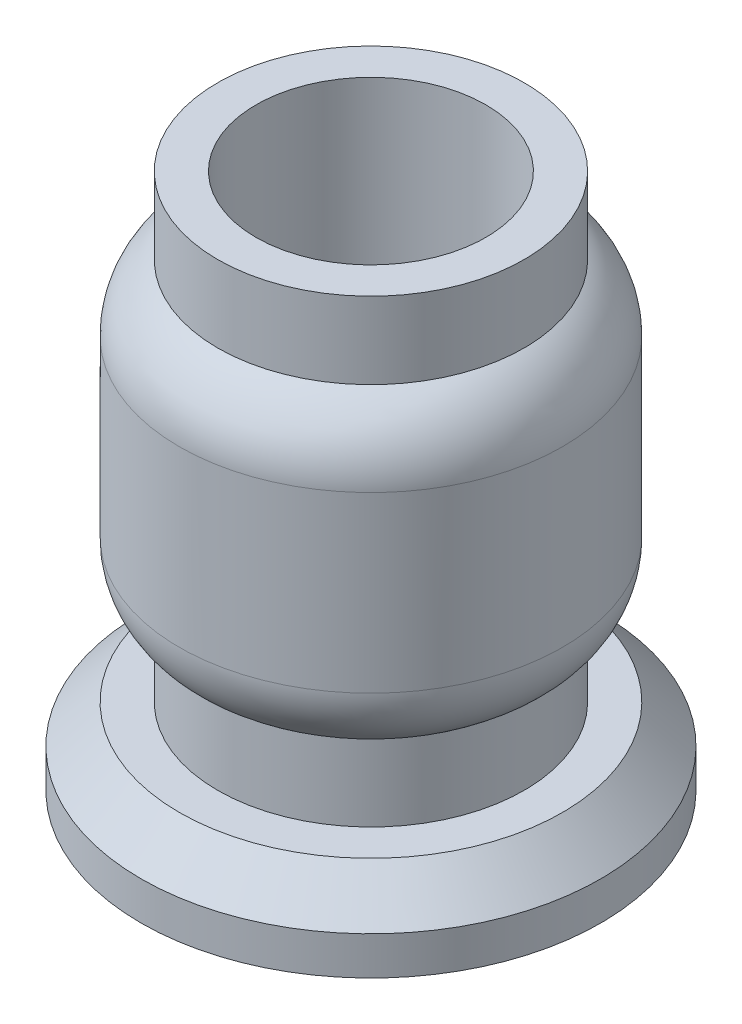
from build123d import *

# Parameters (mm, degrees)
SKETCH1_R           = 3
BOSS_EXTRUDE1_DEPTH = 1
CHAMFER1_SIZE       = 0.5
SKETCH2_R           = 2
BOSS_EXTRUDE2_DEPTH = 1
SKETCH3_R           = 2.5
BOSS_EXTRUDE3_DEPTH = 4
SKETCH4_R           = 2
BOSS_EXTRUDE4_DEPTH = 1
FILLET1_R           = 1
FILLET2_R           = 1
SKETCH5_R           = 1.5
CUT_EXTRUDE1_DEPTH  = 10


with BuildPart() as part:
    # Sketch1 → Boss-Extrude1 (new body)
    with BuildSketch(Plane(origin=(0, 0, 0), x_dir=(1, 0, 0), z_dir=(0, 1, 0))):
        with Locations(Location((0, 0, 0), (0, 0, 270))):
            Circle(SKETCH1_R)
    extrude(amount=BOSS_EXTRUDE1_DEPTH)

    # Chamfer1
    chamfer1_edges = [part.edges().sort_by_distance(p)[0] for p in [
        (0, 1, -3),
    ]]
    chamfer(chamfer1_edges, length=CHAMFER1_SIZE)

    # Sketch2 → Boss-Extrude2 (add)
    with BuildSketch(Plane(origin=(0, 1, 0), x_dir=(1, 0, 0), z_dir=(0, 1, 0))):
        with Locations(Location((0, 0, 0), (0, 0, 270))):
            Circle(SKETCH2_R)
    extrude(amount=BOSS_EXTRUDE2_DEPTH)

    # Sketch3 → Boss-Extrude3 (add)
    with BuildSketch(Plane(origin=(0, 2, 0), x_dir=(1, 0, 0), z_dir=(0, 1, 0))):
        with Locations(Location((0, 0, 0), (0, 0, 270))):
            Circle(SKETCH3_R)
    extrude(amount=BOSS_EXTRUDE3_DEPTH)

    # Sketch4 → Boss-Extrude4 (add)
    with BuildSketch(Plane(origin=(0, 6, 0), x_dir=(1, 0, 0), z_dir=(0, 1, 0))):
        with Locations(Location((0, 0, 0), (0, 0, 270))):
            Circle(SKETCH4_R)
    extrude(amount=BOSS_EXTRUDE4_DEPTH)

    # Fillet1
    # the kernel refuses this fillet: 1 mm, written as the material it takes off along each edge
    with BuildSketch(Plane(origin=(0, 6, 0), x_dir=(0, 0, 1), z_dir=(-1, 0, 0))) as fillet1_piece_1:
        with BuildLine():
            CenterArc((1.5, -0.866025404), FILLET1_R, 0, 60)
            Line((2, 0), (2.01, 0.017320508))
            ThreePointArc((2.01, 0.017320508), (2.25, 0.02), (2.5, 0.02))
            Line((2.5, 0.02), (2.52, 0))
            Line((2.52, 0), (2.52, -0.866025404))
            Line((2.52, -0.866025404), (2.5, -0.866025404))
        make_face()
    revolve(axis=Axis((0, 6, 0), (0, 1, 0)), mode=Mode.SUBTRACT)

    # Fillet2
    # the kernel refuses this fillet: 1 mm, written as the material it takes off along each edge
    with BuildSketch(Plane(origin=(0, 2, 0), x_dir=(0, 0, 1), z_dir=(-1, 0, 0))) as fillet2_piece_1:
        with BuildLine():
            CenterArc((1.5, 0.866025404), FILLET2_R, 300, 60)
            Line((2, 0), (2.01, -0.017320508))
            ThreePointArc((2.01, -0.017320508), (2.25, -0.02), (2.5, -0.02))
            Line((2.5, -0.02), (2.52, 0))
            Line((2.52, 0), (2.52, 0.866025404))
            Line((2.52, 0.866025404), (2.5, 0.866025404))
        make_face()
    revolve(axis=Axis((0, 2, 0), (0, 1, 0)), mode=Mode.SUBTRACT)

    # Sketch5 → Cut-Extrude1 (cut)
    with BuildSketch(Plane.XZ):
        with Locations(Location((0, 0, 0), (0, 0, 270))):
            Circle(SKETCH5_R)
    extrude(amount=-CUT_EXTRUDE1_DEPTH, mode=Mode.SUBTRACT)


solid = part.part
